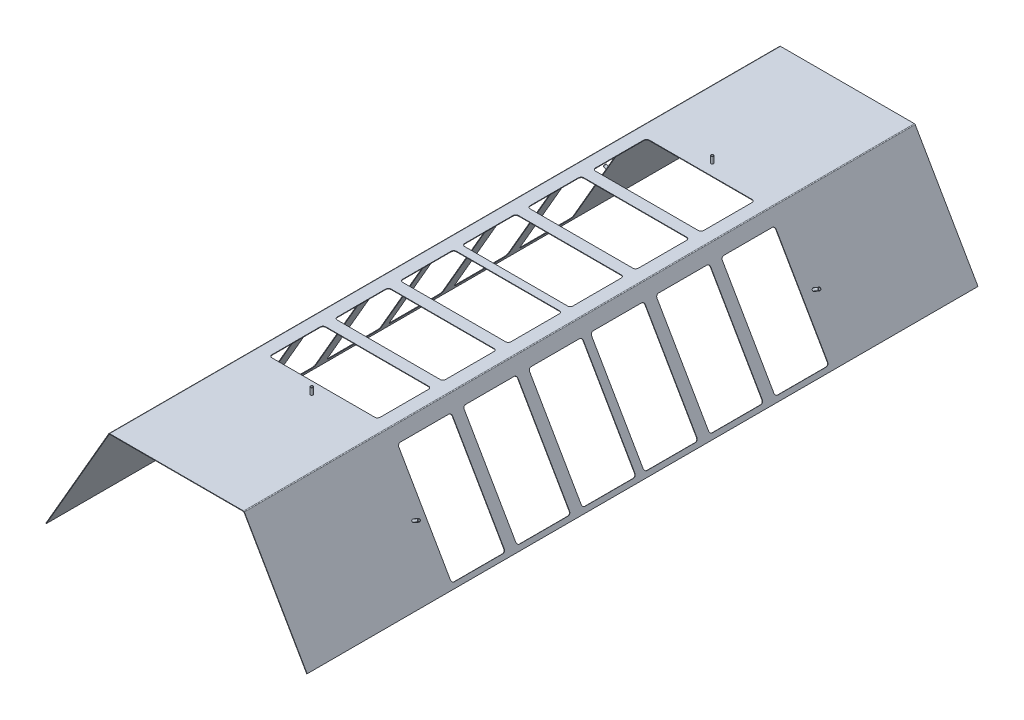
from build123d import *

# Parameters (mm, degrees)
EXTRUDE_1_DEPTH       = 985
SHEET_START           = -985
SHEET_METAL_1_DEPTH   = 1970
SHEET_METAL_1_2_DEPTH = 1970
OTHER_START           = -343.410161514
OTHER_1_DEPTH         = 1.5
OTHER_START_2         = 341.910161514
OTHER_1_2_DEPTH       = 1.5
OTHER_1_3_DEPTH       = 1.5
SKETCH_2_R            = 4
EXTRUDE_1_2_DEPTH     = 20
SKETCH_3_R            = 4
EXTRUDE_2_DEPTH       = 20
CHAMFER_1_SIZE        = 1


# Read off the part's stored shape, not the designer's step: Преобразовать-Твердое тело1, Полость1
with BuildPart() as part:
    # Sketch 1 → Extrude 1 (new, symmetric)
    with BuildSketch(Plane.XY):
        Polygon((382.154009929, 21.910161514), (197.401923789, 341.910161514), (-197.401923789, 341.910161514), (-382.154009929, 21.910161514), (-383.453048035, 22.660161514), (-198.267949192, 343.410161514), (198.267949192, 343.410161514), (383.453048035, 22.660161514), align=None)
    extrude(amount=EXTRUDE_1_DEPTH, both=True)

    # Sheet Metal 1 outline → Sheet Metal 1 (cut)
    with BuildSketch(Plane.XY.offset(SHEET_START)):
        with BuildLine():
            Line((198.267949192, 343.410161514), (196.535898385, 343.410161514))
            ThreePointArc((196.535898385, 343.410161514), (198.035898385, 343.008237725), (199.133974596, 341.910161514))
            Line((199.133974596, 341.910161514), (198.267949192, 343.410161514))
        make_face()
        with BuildLine():
            ThreePointArc((-199.133974596, 341.910161514), (-198.035898385, 343.008237725), (-196.535898385, 343.410161514))
            Line((-196.535898385, 343.410161514), (-198.267949192, 343.410161514))
            Line((-198.267949192, 343.410161514), (-199.133974596, 341.910161514))
        make_face()
    extrude(amount=SHEET_METAL_1_DEPTH, mode=Mode.SUBTRACT)

    # Sheet Metal 1 2 outline → Sheet Metal 1 2 (add)
    with BuildSketch(Plane.XY.offset(SHEET_START)):
        with BuildLine():
            Line((197.401923789, 341.910161514), (196.535898385, 341.910161514))
            ThreePointArc((196.535898385, 341.910161514), (197.285898385, 341.709199619), (197.834936491, 341.160161514))
            Line((197.834936491, 341.160161514), (197.401923789, 341.910161514))
        make_face()
        with BuildLine():
            ThreePointArc((-197.834936491, 341.160161514), (-197.285898385, 341.709199619), (-196.535898385, 341.910161514))
            Line((-196.535898385, 341.910161514), (-197.401923789, 341.910161514))
            Line((-197.401923789, 341.910161514), (-197.834936491, 341.160161514))
        make_face()
    extrude(amount=SHEET_METAL_1_2_DEPTH)

    # Полость1 outline → Полость1 (cut)
    with BuildSketch(Plane(origin=(0, 0, 0), x_dir=(0.5000000000000022, 0.8660254037844374, 0), z_dir=(0.8660254037844374, -0.5000000000000022, 0)).offset(OTHER_START)):
        with BuildLine():
            ThreePointArc((151, -554), (156.656854249, -551.656854249), (159, -546))
            Line((159, -546), (159, -404))
            ThreePointArc((159, -404), (156.656854249, -398.343145751), (151, -396))
            Line((151, -396), (-151, -396))
            ThreePointArc((-151, -396), (-156.656854249, -398.343145751), (-159, -404))
            Line((-159, -404), (-159, -546))
            ThreePointArc((-159, -546), (-156.656854249, -551.656854249), (-151, -554))
            Line((-151, -554), (151, -554))
        make_face()
        with BuildLine():
            Line((159, -354), (159, -212))
            ThreePointArc((159, -212), (156.656854249, -206.343145751), (151, -204))
            Line((151, -204), (-151, -204))
            ThreePointArc((-151, -204), (-156.656854249, -206.343145751), (-159, -212))
            Line((-159, -212), (-159, -354))
            ThreePointArc((-159, -354), (-156.656854249, -359.656854249), (-151, -362))
            Line((-151, -362), (151, -362))
            ThreePointArc((151, -362), (156.656854249, -359.656854249), (159, -354))
        make_face()
        with BuildLine():
            Line((159, -162), (159, -20))
            ThreePointArc((159, -20), (156.656854249, -14.343145751), (151, -12))
            Line((151, -12), (-151, -12))
            ThreePointArc((-151, -12), (-156.656854249, -14.343145751), (-159, -20))
            Line((-159, -20), (-159, -162))
            ThreePointArc((-159, -162), (-156.656854249, -167.656854249), (-151, -170))
            Line((-151, -170), (151, -170))
            ThreePointArc((151, -170), (156.656854249, -167.656854249), (159, -162))
        make_face()
        with BuildLine():
            Line((159, 20), (159, 162))
            ThreePointArc((159, 162), (156.656854249, 167.656854249), (151, 170))
            Line((151, 170), (-151, 170))
            ThreePointArc((-151, 170), (-156.656854249, 167.656854249), (-159, 162))
            Line((-159, 162), (-159, 20))
            ThreePointArc((-159, 20), (-156.656854249, 14.343145751), (-151, 12))
            Line((-151, 12), (151, 12))
            ThreePointArc((151, 12), (156.656854249, 14.343145751), (159, 20))
        make_face()
        with BuildLine():
            Line((159, 212), (159, 354))
            ThreePointArc((159, 354), (156.656854249, 359.656854249), (151, 362))
            Line((151, 362), (-151, 362))
            ThreePointArc((-151, 362), (-156.656854249, 359.656854249), (-159, 354))
            Line((-159, 354), (-159, 212))
            ThreePointArc((-159, 212), (-156.656854249, 206.343145751), (-151, 204))
            Line((-151, 204), (151, 204))
            ThreePointArc((151, 204), (156.656854249, 206.343145751), (159, 212))
        make_face()
        with BuildLine():
            Line((159, 404), (159, 546))
            ThreePointArc((159, 546), (156.656854249, 551.656854249), (151, 554))
            Line((151, 554), (-151, 554))
            ThreePointArc((-151, 554), (-156.656854249, 551.656854249), (-159, 546))
            Line((-159, 546), (-159, 404))
            ThreePointArc((-159, 404), (-156.656854249, 398.343145751), (-151, 396))
            Line((-151, 396), (151, 396))
            ThreePointArc((151, 396), (156.656854249, 398.343145751), (159, 404))
        make_face()
    extrude(amount=OTHER_1_DEPTH, mode=Mode.SUBTRACT)

    # Other 1 2 outline → Other 1 2 (cut)
    with BuildSketch(Plane(origin=(0, 0, 0), x_dir=(1, 0, 0), z_dir=(0, 1, 0)).offset(OTHER_START_2)):
        with BuildLine():
            Line((-151, 396), (151, 396))
            ThreePointArc((151, 396), (156.656854249, 398.343145751), (159, 404))
            Line((159, 404), (159, 546))
            ThreePointArc((159, 546), (156.656854249, 551.656854249), (151, 554))
            Line((151, 554), (-151, 554))
            ThreePointArc((-151, 554), (-156.656854249, 551.656854249), (-159, 546))
            Line((-159, 546), (-159, 404))
            ThreePointArc((-159, 404), (-156.656854249, 398.343145751), (-151, 396))
        make_face()
        with BuildLine():
            Line((-151, 204), (151, 204))
            ThreePointArc((151, 204), (156.656854249, 206.343145751), (159, 212))
            Line((159, 212), (159, 354))
            ThreePointArc((159, 354), (156.656854249, 359.656854249), (151, 362))
            Line((151, 362), (-151, 362))
            ThreePointArc((-151, 362), (-156.656854249, 359.656854249), (-159, 354))
            Line((-159, 354), (-159, 212))
            ThreePointArc((-159, 212), (-156.656854249, 206.343145751), (-151, 204))
        make_face()
        with BuildLine():
            Line((-151, 12), (151, 12))
            ThreePointArc((151, 12), (156.656854249, 14.343145751), (159, 20))
            Line((159, 20), (159, 162))
            ThreePointArc((159, 162), (156.656854249, 167.656854249), (151, 170))
            Line((151, 170), (-151, 170))
            ThreePointArc((-151, 170), (-156.656854249, 167.656854249), (-159, 162))
            Line((-159, 162), (-159, 20))
            ThreePointArc((-159, 20), (-156.656854249, 14.343145751), (-151, 12))
        make_face()
        with BuildLine():
            Line((151, -12), (-151, -12))
            ThreePointArc((-151, -12), (-156.656854249, -14.343145751), (-159, -20))
            Line((-159, -20), (-159, -162))
            ThreePointArc((-159, -162), (-156.656854249, -167.656854249), (-151, -170))
            Line((-151, -170), (151, -170))
            ThreePointArc((151, -170), (156.656854249, -167.656854249), (159, -162))
            Line((159, -162), (159, -20))
            ThreePointArc((159, -20), (156.656854249, -14.343145751), (151, -12))
        make_face()
        with BuildLine():
            Line((151, -204), (-151, -204))
            ThreePointArc((-151, -204), (-156.656854249, -206.343145751), (-159, -212))
            Line((-159, -212), (-159, -354))
            ThreePointArc((-159, -354), (-156.656854249, -359.656854249), (-151, -362))
            Line((-151, -362), (151, -362))
            ThreePointArc((151, -362), (156.656854249, -359.656854249), (159, -354))
            Line((159, -354), (159, -212))
            ThreePointArc((159, -212), (156.656854249, -206.343145751), (151, -204))
        make_face()
        with BuildLine():
            Line((151, -396), (-151, -396))
            ThreePointArc((-151, -396), (-156.656854249, -398.343145751), (-159, -404))
            Line((-159, -404), (-159, -546))
            ThreePointArc((-159, -546), (-156.656854249, -551.656854249), (-151, -554))
            Line((-151, -554), (151, -554))
            ThreePointArc((151, -554), (156.656854249, -551.656854249), (159, -546))
            Line((159, -546), (159, -404))
            ThreePointArc((159, -404), (156.656854249, -398.343145751), (151, -396))
        make_face()
    extrude(amount=OTHER_1_2_DEPTH, mode=Mode.SUBTRACT)

    # Other 1 3 outline → Other 1 3 (cut)
    with BuildSketch(Plane(origin=(0, 0, 0), x_dir=(0.500000000000006, -0.8660254037844353, 0), z_dir=(0.8660254037844352, 0.5000000000000061, 0)).offset(OTHER_START_2)):
        with BuildLine():
            Line((-151, 396), (151, 396))
            ThreePointArc((151, 396), (156.656854249, 398.343145751), (159, 404))
            Line((159, 404), (159, 546))
            ThreePointArc((159, 546), (156.656854249, 551.656854249), (151, 554))
            Line((151, 554), (-151, 554))
            ThreePointArc((-151, 554), (-156.656854249, 551.656854249), (-159, 546))
            Line((-159, 546), (-159, 404))
            ThreePointArc((-159, 404), (-156.656854249, 398.343145751), (-151, 396))
        make_face()
        with BuildLine():
            Line((-151, 204), (151, 204))
            ThreePointArc((151, 204), (156.656854249, 206.343145751), (159, 212))
            Line((159, 212), (159, 354))
            ThreePointArc((159, 354), (156.656854249, 359.656854249), (151, 362))
            Line((151, 362), (-151, 362))
            ThreePointArc((-151, 362), (-156.656854249, 359.656854249), (-159, 354))
            Line((-159, 354), (-159, 212))
            ThreePointArc((-159, 212), (-156.656854249, 206.343145751), (-151, 204))
        make_face()
        with BuildLine():
            Line((-151, 12), (151, 12))
            ThreePointArc((151, 12), (156.656854249, 14.343145751), (159, 20))
            Line((159, 20), (159, 162))
            ThreePointArc((159, 162), (156.656854249, 167.656854249), (151, 170))
            Line((151, 170), (-151, 170))
            ThreePointArc((-151, 170), (-156.656854249, 167.656854249), (-159, 162))
            Line((-159, 162), (-159, 20))
            ThreePointArc((-159, 20), (-156.656854249, 14.343145751), (-151, 12))
        make_face()
        with BuildLine():
            Line((151, -12), (-151, -12))
            ThreePointArc((-151, -12), (-156.656854249, -14.343145751), (-159, -20))
            Line((-159, -20), (-159, -162))
            ThreePointArc((-159, -162), (-156.656854249, -167.656854249), (-151, -170))
            Line((-151, -170), (151, -170))
            ThreePointArc((151, -170), (156.656854249, -167.656854249), (159, -162))
            Line((159, -162), (159, -20))
            ThreePointArc((159, -20), (156.656854249, -14.343145751), (151, -12))
        make_face()
        with BuildLine():
            Line((151, -204), (-151, -204))
            ThreePointArc((-151, -204), (-156.656854249, -206.343145751), (-159, -212))
            Line((-159, -212), (-159, -354))
            ThreePointArc((-159, -354), (-156.656854249, -359.656854249), (-151, -362))
            Line((-151, -362), (151, -362))
            ThreePointArc((151, -362), (156.656854249, -359.656854249), (159, -354))
            Line((159, -354), (159, -212))
            ThreePointArc((159, -212), (156.656854249, -206.343145751), (151, -204))
        make_face()
        with BuildLine():
            Line((151, -396), (-151, -396))
            ThreePointArc((-151, -396), (-156.656854249, -398.343145751), (-159, -404))
            Line((-159, -404), (-159, -546))
            ThreePointArc((-159, -546), (-156.656854249, -551.656854249), (-151, -554))
            Line((-151, -554), (151, -554))
            ThreePointArc((151, -554), (156.656854249, -551.656854249), (159, -546))
            Line((159, -546), (159, -404))
            ThreePointArc((159, -404), (156.656854249, -398.343145751), (151, -396))
        make_face()
    extrude(amount=OTHER_1_3_DEPTH, mode=Mode.SUBTRACT)

    # Sketch 2 → Extrude 1 2 (add)
    with BuildSketch(Plane(origin=(0, 343.410161514, 0), x_dir=(1, 0, 0), z_dir=(0, 1, 0))):
        with Locations(Location((0, -588, 0), (0, 0, 90))):
            Circle(SKETCH_2_R)
        with Locations(Location((0, 588, 0), (0, 0, 90))):
            Circle(SKETCH_2_R)
    extrude(amount=EXTRUDE_1_2_DEPTH)

    # Эскиз3 → Бобышка-Вытянуть2 (add)
    with BuildSketch(Plane(origin=(-297.401923789, 171.705080757, 0), x_dir=(0, 0, 1), z_dir=(-0.8660254037844386, 0.5000000000000002, 0))):
        with Locations(Location((588, -1.299038106, 0), (0, 0, 90))):
            Circle(SKETCH_3_R)
        with Locations(Location((-588, -1.299038106, 0), (0, 0, 90))):
            Circle(SKETCH_3_R)
    extrude_2 = extrude(amount=EXTRUDE_2_DEPTH)

    # Зеркальное отражение1: Бобышка-Вытянуть2 across plane
    add(extrude_2.mirror(Plane(origin=(0, 0, 0), x_dir=(0, 0, 1), z_dir=(1, 0, 0))))

    # Фаска1
    chamfer_1_edges = [part.edges().sort_by_distance(p)[0] for p in [
        (0, 363.410161514, 592),
        (0, 363.410161514, -584),
        (-317.371950917, 177.115979142, -588),
        (-317.371950917, 177.115979142, 588),
        (317.371950917, 177.115979142, -588),
        (317.371950917, 177.115979142, 588),
    ]]
    chamfer(chamfer_1_edges, length=CHAMFER_1_SIZE)


solid = part.part
